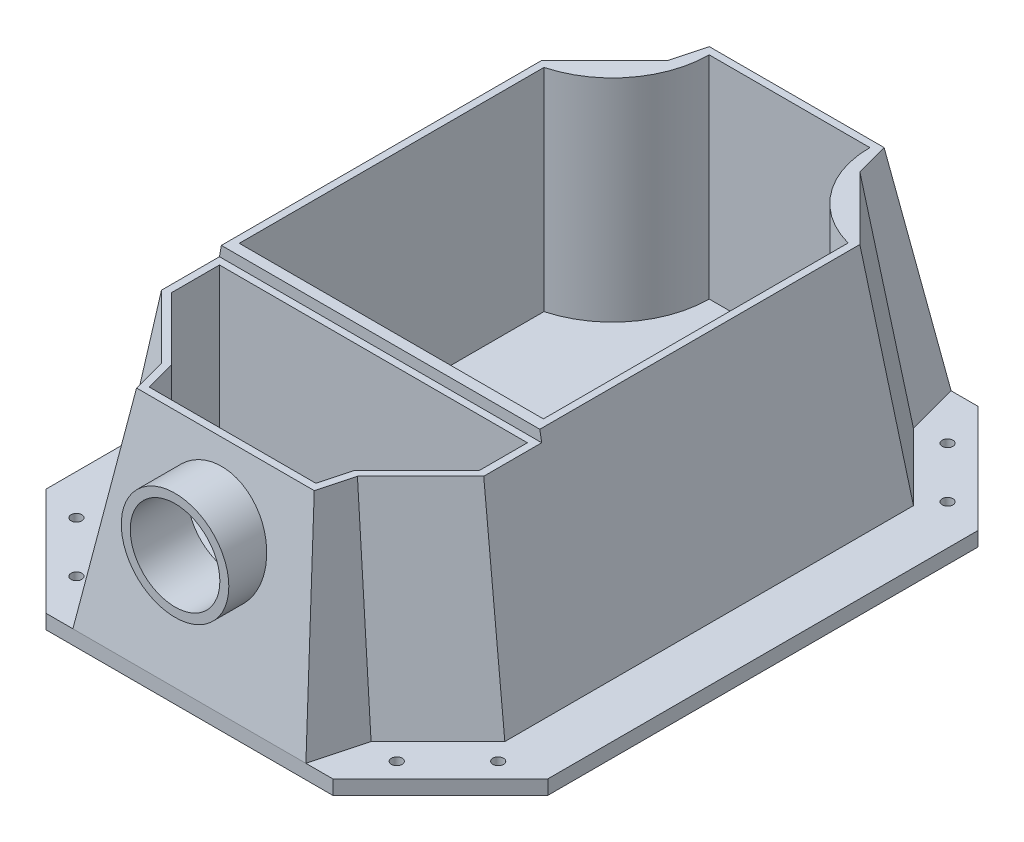
from build123d import *

# Parameters (mm, degrees)
BOSS_EXTRUDE1_DEPTH = 4
SKETCH2_R           = 1.5
CUT_EXTRUDE1_DEPTH  = 90
BOSS_EXTRUDE2_DEPTH = 60
BOSS_EXTRUDE2_TAPER = 10
SKETCH7_W           = 175.241163986
SKETCH7_H           = 63.70934739
CUT_EXTRUDE4_DEPTH  = 3
CUT_EXTRUDE5_DEPTH  = 56
CUT_EXTRUDE6_DEPTH  = 56
BOSS_EXTRUDE3_REACH = 209.007
SKETCH5_R           = 15
SKETCH6_R           = 12.5
CUT_EXTRUDE3_DEPTH  = 40
SKETCH14_RX         = 22.7346222
SKETCH14_RY         = 6.165321274
CUT_EXTRUDE8_DEPTH  = 56


with BuildPart() as part:
    # Sketch1 → Boss-Extrude1 (new body)
    with BuildSketch(Plane(origin=(0, 0, 0), x_dir=(1, 0, 0), z_dir=(0, 1, 0))):
        Polygon((-70, 60), (-40, 90), (40, 90), (70, 60), (70, -60), (40, -90), (-40, -90), (-70, -60), align=None)
    extrude(amount=BOSS_EXTRUDE1_DEPTH)

    # Sketch2 → Cut-Extrude1 (cut)
    with BuildSketch(Plane(origin=(0, 4, 0), x_dir=(1, 0, 0), z_dir=(0, 1, 0))):
        with Locations((-58.828427125, 62.686291501)):
            Circle(SKETCH2_R)
        with Locations((-44.686291501, 76.828427125)):
            Circle(SKETCH2_R)
        with Locations((44.686291501, 76.828427125)):
            Circle(SKETCH2_R)
        with Locations((58.828427125, 62.686291501)):
            Circle(SKETCH2_R)
        with Locations((58.828427125, -62.686291501)):
            Circle(SKETCH2_R)
        with Locations((44.686291501, -76.828427125)):
            Circle(SKETCH2_R)
        with Locations((-44.686291501, -76.828427125)):
            Circle(SKETCH2_R)
        with Locations((-58.828427125, -62.686291501)):
            Circle(SKETCH2_R)
    extrude(amount=-CUT_EXTRUDE1_DEPTH, mode=Mode.SUBTRACT)

    # Sketch4 → Boss-Extrude2 (add)
    with BuildSketch(Plane(origin=(0, 4, 0), x_dir=(1, 0, 0), z_dir=(0, 1, 0))):
        Polygon((-55, -57), (-36.34326674, -75.65673326), (-32.5, -90), (32.5, -90), (36.34326674, -75.65673326), (55, -57), (55, 57), (36.34326674, 75.65673326), (32.5, 90), (-32.5, 90), (-36.34326674, 75.65673326), (-55, 57), align=None)
    extrude(amount=BOSS_EXTRUDE2_DEPTH, taper=BOSS_EXTRUDE2_TAPER)

    # Sketch7 → Cut-Extrude4 (cut)
    with BuildSketch(Plane(origin=(0, 64, 0), x_dir=(1, 0, 0), z_dir=(0, 1, 0))):
        with BuildLine():
            Line((22.408495375, 77.420381157), (-22.408495375, 77.420381157))
            ThreePointArc((-22.408495375, 77.420381157), (-27.987955187, 60.983822574), (-42.420381157, 51.340383848))
            Line((-42.420381157, 51.340383848), (-42.420381157, -33.659616152))
            Line((-42.420381157, -33.659616152), (42.420381157, -33.659616152))
            Line((42.420381157, -33.659616152), (42.420381157, 51.340383848))
            ThreePointArc((42.420381157, 51.340383848), (27.987955187, 60.983822574), (22.408495375, 77.420381157))
        make_face()
        with Locations((0, -68.514289847)):
            Rectangle(SKETCH7_W, SKETCH7_H)
    extrude(amount=-CUT_EXTRUDE4_DEPTH, mode=Mode.SUBTRACT)

    # Sketch11 → Cut-Extrude5 (cut)
    with BuildSketch(Plane(origin=(0, 61, 0), x_dir=(1, 0, 0), z_dir=(0, 1, 0))):
        with BuildLine():
            Line((-42.420381157, 51.340383848), (-42.420381157, -33.659616152))
            Line((-42.420381157, -33.659616152), (42.420381157, -33.659616152))
            Line((42.420381157, -33.659616152), (42.420381157, 51.340383848))
            ThreePointArc((42.420381157, 51.340383848), (27.987955187, 60.983822574), (22.408495375, 77.420381157))
            Line((22.408495375, 77.420381157), (-22.408495375, 77.420381157))
            ThreePointArc((-22.408495375, 77.420381157), (-27.987955187, 60.983822574), (-42.420381157, 51.340383848))
        make_face()
    extrude(amount=-CUT_EXTRUDE5_DEPTH, mode=Mode.SUBTRACT)

    # Sketch12 → Cut-Extrude6 (cut)
    with BuildSketch(Plane(origin=(0, 61, 0), x_dir=(1, 0, 0), z_dir=(0, 1, 0))):
        Polygon((-42.9493621, -52.008462346), (-25.538960374, -69.418864072), (-23.253220317, -77.9493621), (23.253220317, -77.9493621), (25.538960374, -69.418864072), (42.9493621, -52.008462346), (42.9493621, -38.659616152), (-42.9493621, -38.659616152), align=None)
    extrude(amount=-CUT_EXTRUDE6_DEPTH, mode=Mode.SUBTRACT)

    # Boss-Extrude3: up to this plane
    boss_extrude3_end = Plane(origin=(-32.5, 4, 90), z_dir=(0, 0.17364817766693072, 0.984807753012208))
    # Sketch5 → Boss-Extrude3 (add, up to the surface)
    with BuildSketch(Plane.XY.offset(94), mode=Mode.PRIVATE) as boss_extrude3_sk1:
        with Locations((0, 40)):
            Circle(SKETCH5_R)
    boss_extrude3_tool1 = split(extrude(boss_extrude3_sk1.sketch, amount=-BOSS_EXTRUDE3_REACH, mode=Mode.PRIVATE), bisect_by=boss_extrude3_end, keep=Keep.BOTH, mode=Mode.PRIVATE)
    add(boss_extrude3_tool1.solids().sort_by_distance((0, 40, 94))[0])

    # Sketch6 → Cut-Extrude3 (cut)
    with BuildSketch(Plane.XY.offset(94)):
        with Locations((0, 40)):
            Circle(SKETCH6_R)
    extrude(amount=-CUT_EXTRUDE3_DEPTH, mode=Mode.SUBTRACT)

    # Sketch14 → Cut-Extrude8 (cut)
    with BuildSketch(Plane(origin=(0, 5, 0), x_dir=(1, 0, 0), z_dir=(0, 1, 0))):
        with Locations((0, -49.652795684)):
            Ellipse(SKETCH14_RX, SKETCH14_RY)
    extrude(amount=-CUT_EXTRUDE8_DEPTH, mode=Mode.SUBTRACT)


solid = part.part
